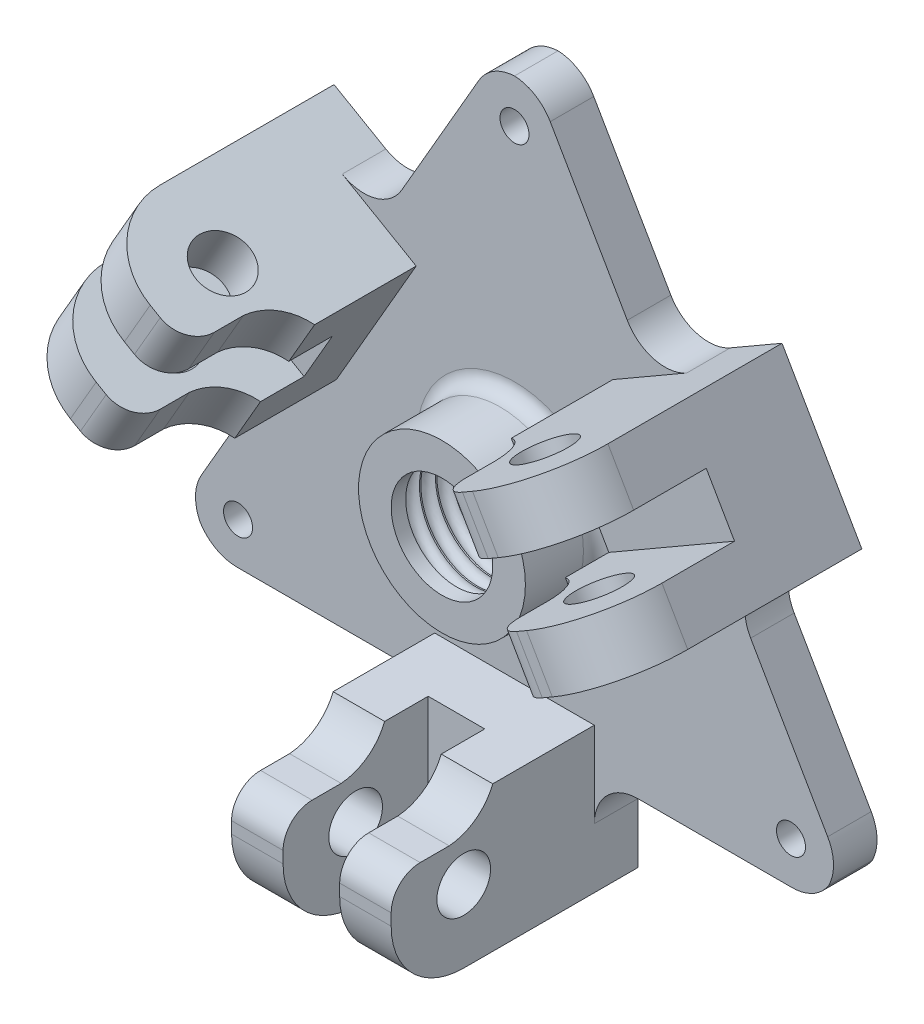
from build123d import *

# Parameters (mm, degrees)
SKETCH1_R           = 25
SKETCH1_R_2         = 5.75
SKETCH1_R_3         = 1
BOSS_EXTRUDE1_DEPTH = 3
SKETCH1_7_R         = 5.75
SKETCH1_7_R_2       = 4
BOSS_EXTRUDE2_DEPTH = 8
CUT_SWEEP1_PITCH    = 1.1
SKETCH59_R          = 5
SKETCH59_R_2        = 3.5
BOSS_EXTRUDE4_DEPTH = 1
SKETCH66_R          = 5
CUT_EXTRUDE3_DEPTH  = 3
CUT_EXTRUDE3_DRAFT  = -45
SKETCH67_W          = 11
SKETCH67_H          = 10
BOSS_EXTRUDE5_DEPTH = 14
SKETCH68_W          = 3.9
SKETCH68_H          = 12.438724808
CUT_EXTRUDE4_DEPTH  = 10
SKETCH70_R          = 1.85
CUT_EXTRUDE5_DEPTH  = 15
CIRPATTERN1_COUNT   = 3
FILLET1_R           = 5
FILLET2_R           = 2
CUT_EXTRUDE6_START  = -10
CUT_EXTRUDE6_DEPTH  = 10
FILLET3_R           = 3
FILLET4_R           = 1


with BuildPart() as part:
    # Sketch1 → Boss-Extrude1 (new body)
    with BuildSketch(Plane.XY):
        Circle(SKETCH1_R)
        Circle(SKETCH1_R_2, mode=Mode.SUBTRACT)
        with Locations((0, 22)):
            Circle(SKETCH1_R_3, mode=Mode.SUBTRACT)
        with Locations((19.052558883, -11)):
            Circle(SKETCH1_R_3, mode=Mode.SUBTRACT)
        with Locations((-19.052558883, -11)):
            Circle(SKETCH1_R_3, mode=Mode.SUBTRACT)
    extrude(amount=BOSS_EXTRUDE1_DEPTH)

    # Sketch1<7> → Boss-Extrude2 (add)
    with BuildSketch(Plane.XY):
        Circle(SKETCH1_7_R)
        Circle(SKETCH1_7_R_2, mode=Mode.SUBTRACT)
    extrude(amount=BOSS_EXTRUDE2_DEPTH)

    # Cut-Sweep1: arcs per turn and ends read off the stored shape
    # Cut-Sweep1: the profile of Cut-Sweep1 profile screwed along a right-hand helix through 9 turns, 8 arcs to a turn; built about Z, then put on its axis
    cut_sweep1_z = Axis((0, 0, 0), (0, 0, 1))
    cut_sweep1_corners = [(4, -0.021862874, -0.600478214), (4.5, 0, -1.1), (4, 0.021862874, -1.599521786), (3.5, 0, -1.1)]
    with BuildLine(mode=Mode.PRIVATE) as cut_sweep1_profile:
        ThreePointArc((4, -0.021862874, -0.600478214), (4.353553391, -0.015459387, -0.746784758), (4.5, 0, -1.1))
        ThreePointArc((4.5, 0, -1.1), (4.353553391, 0.015459387, -1.453215242), (4, 0.021862874, -1.599521786))
        ThreePointArc((4, 0.021862874, -1.599521786), (3.646446609, 0.015459387, -1.453215242), (3.5, 0, -1.1))
        ThreePointArc((3.5, 0, -1.1), (3.646446609, -0.015459387, -0.746784758), (4, -0.021862874, -0.600478214))
    cut_sweep1_cap = Face(cut_sweep1_profile.wire())
    cut_sweep1_arcs = [((4, -0.021862874, -0.600478214), (4.5, -0.021862874, -0.600478214), (4.5, 0, -1.1), (1, 0.7071067811865476, 1)), ((4.5, 0, -1.1), (4.5, 0.021862874, -1.599521786), (4, 0.021862874, -1.599521786), (1, 0.7071067811865476, 1)), ((4, 0.021862874, -1.599521786), (3.5, 0.021862874, -1.599521786), (3.5, 0, -1.1), (1, 0.7071067811865476, 1)), ((3.5, 0, -1.1), (3.5, -0.021862874, -0.600478214), (4, -0.021862874, -0.600478214), (1, 0.7071067811865476, 1))]  # start, shoulder, end, weights
    cut_sweep1_turn_angles = [0, 22.5, 45, 67.5, 90, 112.5, 135, 157.5, 180, 202.5, 225, 247.5, 270, 292.5, 315, 337.5, 360]
    cut_sweep1_turn_weights = [1, 0.9238795325112867, 1, 0.9238795325112867, 1, 0.9238795325112867, 1, 0.9238795325112867, 1, 0.9238795325112867, 1, 0.9238795325112867, 1, 0.9238795325112867, 1, 0.9238795325112867, 1]
    cut_sweep1_turn_sides = [Face.make_bezier_surface([[Vector(p[j][0], p[j][1], 0).rotate(cut_sweep1_z, cut_sweep1_turn_angles[2 * i + k]) / cut_sweep1_turn_weights[2 * i + k] + Vector(0, 0, p[j][2] + CUT_SWEEP1_PITCH * cut_sweep1_turn_angles[2 * i + k] / 360) for k in range(3)] for j in range(3)], [[p[3][j] * cut_sweep1_turn_weights[2 * i + k] for k in range(3)] for j in range(3)]) for p in cut_sweep1_arcs for i in range(8)]
    cut_sweep1 = Plane(origin=(0, 0, 0), x_dir=(1, 0, 0), z_dir=(0, 0, 1)) * Solid(Shell([*[p.moved(Location((0, 0, CUT_SWEEP1_PITCH * i))) for i in range(9) for p in cut_sweep1_turn_sides], cut_sweep1_cap, cut_sweep1_cap.rotate(cut_sweep1_z, 3240).moved(Location((0, 0, CUT_SWEEP1_PITCH * 3240 / 360)))]))
    add(cut_sweep1, mode=Mode.SUBTRACT)

    # Sketch59 → Boss-Extrude4 (add)
    with BuildSketch(Plane.XY.offset(8)):
        Circle(SKETCH59_R)
        Circle(SKETCH59_R_2, mode=Mode.SUBTRACT)
    extrude(amount=-BOSS_EXTRUDE4_DEPTH)


with BuildPart() as cut_extrude3_tool:
    # Sketch66 → Cut-Extrude3 (with draft: the straight prism first)
    with BuildSketch(Plane(origin=(0, 0, 0), x_dir=(-1, 0, 0), z_dir=(0, 0, -1))):
        Circle(SKETCH66_R)
    extrude(amount=-CUT_EXTRUDE3_DEPTH)
    # Cut-Extrude3: the draft: its side faces are tilted about the plane it starts from
    cut_extrude3_sides = [cut_extrude3_tool.faces().sort_by_distance(p)[0] for p in [
        (5, 0, 1.5),
    ]]
    draft(cut_extrude3_sides, Plane(origin=(0, 0, 0), x_dir=(-1, 0, 0), z_dir=(0, 0, -1)), CUT_EXTRUDE3_DRAFT)


with BuildPart() as part_1:
    add(part.part)

    # Cut-Extrude3: cut by cut_extrude3_tool
    add(cut_extrude3_tool.part, mode=Mode.SUBTRACT)

    # Sketch67 → Boss-Extrude5 (add)
    with BuildSketch(Plane.XY.offset(3)):
        Polygon((15.436533479, 15.263139721), (20.936533479, 5.736860279), (12.276279442, 0.736860279), (6.776279442, 10.263139721), align=None)
        with Locations((0, -16)):
            Rectangle(SKETCH67_W, SKETCH67_H)
        Polygon((-20.936533479, 5.736860279), (-15.436533479, 15.263139721), (-6.776279442, 10.263139721), (-12.276279442, 0.736860279), align=None)
    extrude(amount=BOSS_EXTRUDE5_DEPTH)

    # Sketch68 → Cut-Extrude4 (cut)
    with BuildSketch(Plane.XY.offset(17)):
        Polygon((8.551279442, 7.188749537), (19.323531116, 13.408111942), (21.273531116, 10.030612867), (10.501279442, 3.811250463), align=None)
        with Locations((0, -17.219362404)):
            Rectangle(SKETCH68_W, SKETCH68_H)
        Polygon((-10.501279442, 3.811250463), (-21.273531116, 10.030612867), (-19.323531116, 13.408111942), (-8.551279442, 7.188749537), align=None)
    extrude(amount=-CUT_EXTRUDE4_DEPTH, mode=Mode.SUBTRACT)

    # Sketch70 → Cut-Extrude5 (cut)
    with BuildSketch(Plane(origin=(2.75, -4.763139721, 0), x_dir=(0.8660254037844398, 0.49999999999999806, 0), z_dir=(0.499999999999998, -0.8660254037844397, 0))):
        with Locations((16, 12)):
            Circle(SKETCH70_R)
        with BuildLine():
            Line((13.2, 13), (13.2, 17))
            Line((13.2, 17), (11, 17))
            Line((11, 17), (11, 10))
            ThreePointArc((11, 10), (12.531593263, 11.183498274), (13.2, 13))
        make_face()
    cut_extrude5 = extrude(amount=-CUT_EXTRUDE5_DEPTH, mode=Mode.SUBTRACT)

    # CirPattern1: Cut-Extrude5 ×3 about axis
    cirpattern1_axis = Axis((0, 0, 0), (0, 0, 1))
    for i in range(1, CIRPATTERN1_COUNT):
        add(cut_extrude5.rotate(cirpattern1_axis, i * 360 / CIRPATTERN1_COUNT), mode=Mode.SUBTRACT)

    # Fillet1
    fillet1_edges = [part_1.edges().sort_by_distance(p)[0] for p in [
        (16.324033479, 13.725944629, 17),
        (20.049033479, 7.274055371, 17),
        (-3.725, -21, 17),
        (-16.324033479, 13.725944629, 17),
        (-20.049033479, 7.274055371, 17),
        (3.725, -21, 17),
    ]]
    fillet(fillet1_edges, radius=FILLET1_R)

    # Fillet2
    fillet2_edges = [part_1.edges().sort_by_distance(p)[0] for p in [
        (9.56903533, 9.825944629, 17),
        (13.29403533, 3.374055371, 17),
        (-13.29403533, 3.374055371, 17),
        (-9.56903533, 9.825944629, 17),
        (3.725, -13.2, 17),
        (-3.725, -13.2, 17),
    ]]
    fillet(fillet2_edges, radius=FILLET2_R)

    # Sketch71 → Cut-Extrude6 (cut)
    with BuildSketch(Plane.XY.offset(3).offset(CUT_EXTRUDE6_START)):
        with BuildLine():
            Line((-9.271992934, 11.704040577), (-1.626133407, 24.947057745))
            ThreePointArc((-1.626133407, 24.947057745), (-21.650635095, 12.5), (-22.417852461, -11.065256032))
            Line((-22.417852461, -11.065256032), (-14.771992934, 2.177761136))
            Line((-14.771992934, 2.177761136), (-20.936533479, 5.736860279))
            Line((-20.936533479, 5.736860279), (-15.436533479, 15.263139721))
            Line((-15.436533479, 15.263139721), (-9.271992934, 11.704040577))
        make_face()
        with BuildLine():
            ThreePointArc((22.417852461, -11.065256032), (21.650635095, 12.5), (1.626133407, 24.947057745))
            Line((1.626133407, 24.947057745), (9.271992934, 11.704040577))
            Line((9.271992934, 11.704040577), (15.436533479, 15.263139721))
            Line((15.436533479, 15.263139721), (20.936533479, 5.736860279))
            Line((20.936533479, 5.736860279), (14.771992934, 2.177761136))
            Line((14.771992934, 2.177761136), (22.417852461, -11.065256032))
        make_face()
        with BuildLine():
            Line((-5.5, -13.881801713), (-20.791719053, -13.881801713))
            ThreePointArc((-20.791719053, -13.881801713), (0, -25), (20.791719053, -13.881801713))
            Line((20.791719053, -13.881801713), (5.5, -13.881801713))
            Line((5.5, -13.881801713), (5.5, -21))
            Line((5.5, -21), (-5.5, -21))
            Line((-5.5, -21), (-5.5, -13.881801713))
        make_face()
    extrude(amount=CUT_EXTRUDE6_DEPTH, mode=Mode.SUBTRACT)

    # Fillet3
    # the kernel refuses this fillet: 3 mm, written as the material it adds along each edge
    with BuildSketch(Plane(origin=(-14.771992934, 2.177761136, 0), x_dir=(-0.499999999999996, -0.8660254037844409, 0), z_dir=(0, 0, 1)), Plane(origin=(-5.5, -13.881801713, 0), x_dir=(0, -1, 0), z_dir=(0, 0, 1)), Plane(origin=(14.771992934, 2.177761136, 0), x_dir=(0.8660254037844621, 0.4999999999999593, 0), z_dir=(0, 0, 1)), Plane(origin=(9.271992934, 11.704040577, 0), x_dir=(-0.5000000000000039, 0.8660254037844365, 0), z_dir=(0, 0, 1)), Plane(origin=(-9.271992934, 11.704040577, 0), x_dir=(-0.866025403784437, 0.5000000000000029, 0), z_dir=(0, 0, 1))) as fillet3_piece_1:
        with BuildLine():
            CenterArc((FILLET3_R, -FILLET3_R), FILLET3_R, 90, 90)
            Line((0, -FILLET3_R), (0, 0))
            Line((0, 0), (FILLET3_R, 0))
        make_face()
    extrude(amount=3)
    with BuildSketch(Plane(origin=(5.5, -13.881801713, 0), x_dir=(0, -1, 0), z_dir=(0, 0, 1))) as fillet3_piece_2:
        with BuildLine():
            CenterArc((FILLET3_R, FILLET3_R), FILLET3_R, 180, 90)
            Line((0, FILLET3_R), (0, 0))
            Line((0, 0), (FILLET3_R, 0))
        make_face()
    extrude(amount=3)
    # the kernel refuses this fillet: 3 mm, written as the material it takes off along each edge
    with BuildSketch(Plane(origin=(-20.791719053, -13.881801713, -4.454310548), x_dir=(1, 0, 0), z_dir=(0, 0, 1)), Plane(origin=(22.417852461, -11.065256032, -4.454310548), x_dir=(-0.4999999999999947, 0.8660254037844417, 0), z_dir=(0, 0, 1)), Plane(origin=(-1.626133407, 24.947057745, -4.454310548), x_dir=(-0.5000000000000032, -0.8660254037844368, 0), z_dir=(0, 0, 1))) as fillet3_2_piece_1:
        with BuildLine():
            CenterArc((1.671405471, 3), FILLET3_R, 209.645180417, 60.354819583)
            ThreePointArc((-0.935910017, 1.516117948), (-0.481465819, 0.749718658), (0, 0))
            Line((0, 0), (1.671405471, 0))
        make_face()
    extrude(amount=11.908621096, mode=Mode.SUBTRACT)
    with BuildSketch(Plane(origin=(-22.417852461, -11.065256032, -4.454310548), x_dir=(0.4742830796658374, -0.8803723986715446, 0), z_dir=(0, 0, 1)), Plane(origin=(20.791719053, -13.881801713, -4.454310548), x_dir=(0.5252833222072777, 0.8509273949115079, 0), z_dir=(0, 0, 1)), Plane(origin=(1.626133407, 24.947057745, -4.454310548), x_dir=(-0.9995664018731178, 0.029445003760038335, 0), z_dir=(0, 0, 1))) as fillet3_2_piece_2:
        with BuildLine():
            CenterArc((1.674820766, 2.99809467), FILLET3_R, 211.687318323, 60.354819583)
            Line((-0.877961419, 1.422244704), (0, 0))
            ThreePointArc((0, 0), (0.89086211, -0.015877748), (1.781724219, 0))
        make_face()
    extrude(amount=11.908621096, mode=Mode.SUBTRACT)

    # Fillet4
    fillet4_edges = [part_1.edges().sort_by_distance(p)[0] for p in [
        (-5.75, 0, 3),
    ]]
    fillet(fillet4_edges, radius=FILLET4_R)


solid = part_1.part
